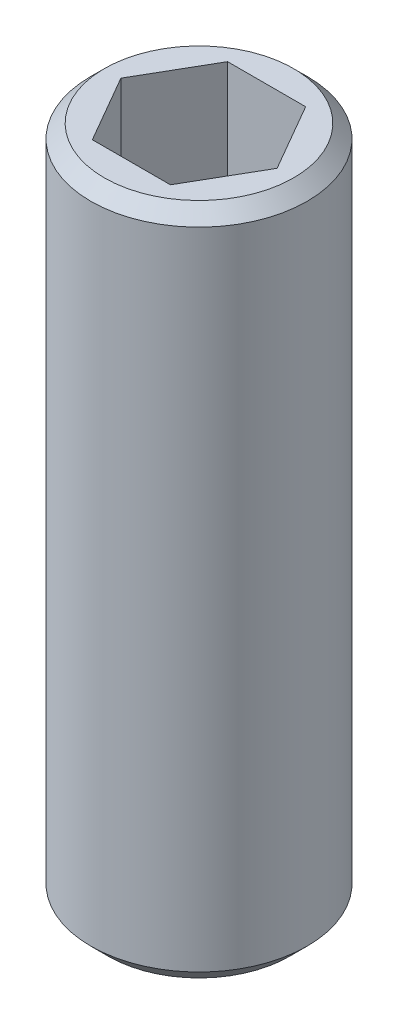
from build123d import *

# Parameters (mm, degrees)
SKETCH1_R                 = 4
BOSS_EXTRUDE1_DEPTH       = 25
F_5_0MM_DOWEL_HOLE1_D     = 5
F_5_0MM_DOWEL_HOLE1_DEPTH = 6
F_5_0MM_DOWEL_HOLE1_TIP   = 1.502151548
CUT_EXTRUDE1_DEPTH        = 6
CHAMFER1_SIZE             = 0.5
CHAMFER2_SIZE             = 0.65


with BuildPart() as part:
    # Sketch1 → Boss-Extrude1 (new body)
    with BuildSketch(Plane(origin=(0, 0, 0), x_dir=(1, 0, 0), z_dir=(0, 1, 0))):
        Circle(SKETCH1_R)
    extrude(amount=BOSS_EXTRUDE1_DEPTH)

    # Ø5.0mm Dowel Hole1
    with Locations(Plane(origin=(0, 25, 0), x_dir=(1, 0, 0), z_dir=(0, 1, 0))):
        with Locations((0, 0)):
            Hole(F_5_0MM_DOWEL_HOLE1_D / 2, depth=F_5_0MM_DOWEL_HOLE1_DEPTH)
            with Locations((0, 0, -(F_5_0MM_DOWEL_HOLE1_DEPTH + F_5_0MM_DOWEL_HOLE1_TIP / 2))):  # 118° drill point
                Cone(0, F_5_0MM_DOWEL_HOLE1_D / 2, F_5_0MM_DOWEL_HOLE1_TIP, mode=Mode.SUBTRACT)

    # Sketch2 → Cut-Extrude1 (cut)
    with BuildSketch(Plane(origin=(0, 25, 0), x_dir=(1, 0, 0), z_dir=(0, 1, 0))):
        Polygon((2.886751346, 0), (1.443375673, 2.5), (-1.443375673, 2.5), (-2.886751346, 0), (-1.443375673, -2.5), (1.443375673, -2.5), align=None)
    extrude(amount=-CUT_EXTRUDE1_DEPTH, mode=Mode.SUBTRACT)

    # Chamfer1
    chamfer1_edges = [part.edges().sort_by_distance(p)[0] for p in [
        (-4, 25, 0),
    ]]
    chamfer(chamfer1_edges, length=CHAMFER1_SIZE)

    # Chamfer2
    chamfer2_edges = [part.edges().sort_by_distance(p)[0] for p in [
        (-4, 0, 0),
    ]]
    chamfer(chamfer2_edges, length=CHAMFER2_SIZE)


solid = part.part
